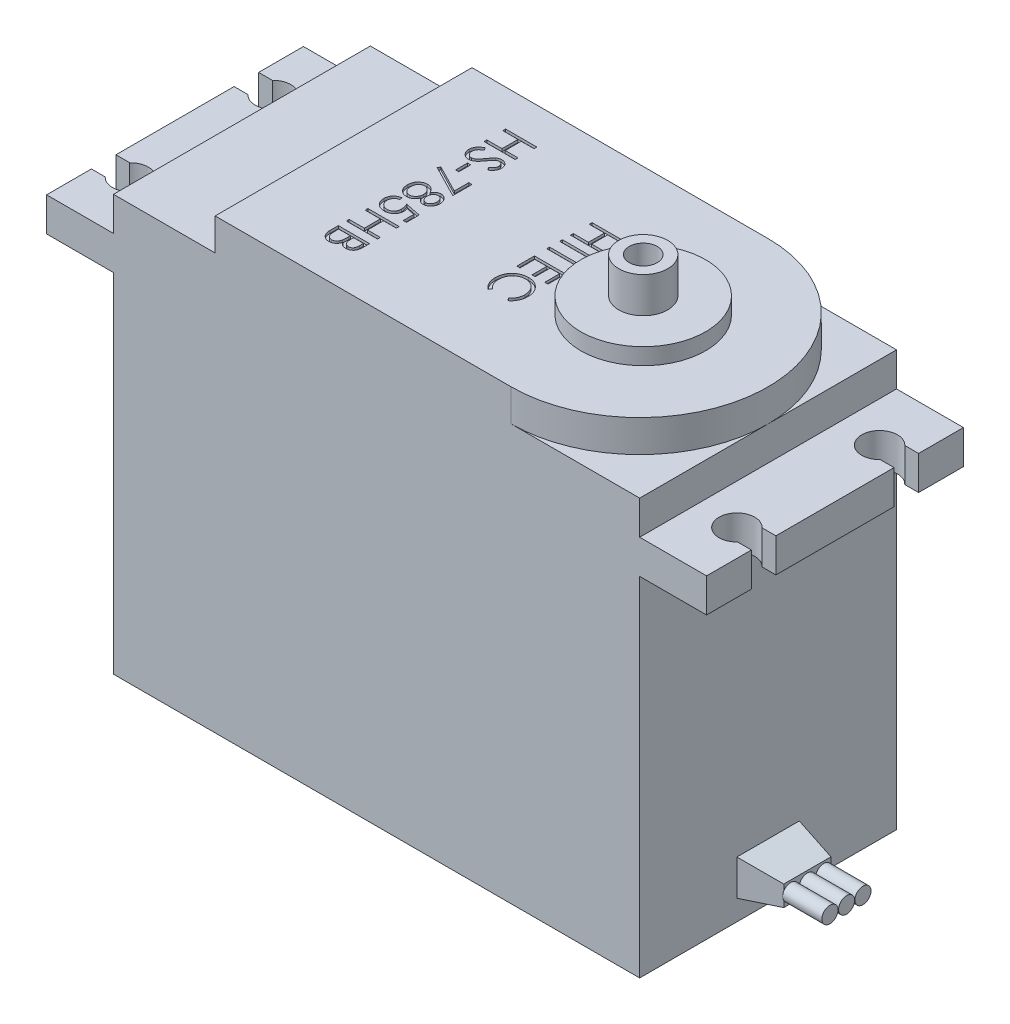
from build123d import *

# Parameters (mm, degrees)
SKETCH1_W                        = 59
SKETCH1_H                        = 46.6
BOSS_EXTRUDE1_DEPTH              = 28.8
BOSS_EXTRUDE2_DEPTH              = 3.6
SKETCH3_R                        = 7
BOSS_EXTRUDE3_DEPTH              = 1.85
BOSS_EXTRUDE4_DEPTH              = 3.8
SKETCH5_W                        = 7
SKETCH5_H                        = 4
BOSS_EXTRUDE5_DEPTH              = 4.4
BOSS_EXTRUDE5_TAPER              = 11
SKETCH6_R                        = 0.902956787
BOSS_EXTRUDE6_DEPTH              = 4.4
SKETCH7_R                        = 2.75
BOSS_EXTRUDE7_DEPTH              = 4
TAP_DRILL_FOR_M3_HELICOIL1_D     = 3.15
TAP_DRILL_FOR_M3_HELICOIL1_DEPTH = 3
TAP_DRILL_FOR_M3_HELICOIL1_TIP   = 0.946355475
SKETCH10_W                       = 3.5
SKETCH10_H                       = 0.314102564
SKETCH10_W_2                     = 0.358974359
SKETCH10_H_2                     = 1.346153846
CUT_EXTRUDE1_DEPTH               = 0.3


with BuildPart() as part:
    # Sketch1 → Boss-Extrude1 (new body)
    with BuildSketch(Plane.XY):
        with Locations((29.5, 23.3)):
            Rectangle(SKETCH1_W, SKETCH1_H)
    extrude(amount=BOSS_EXTRUDE1_DEPTH)

    # Sketch2 → Boss-Extrude2 (add)
    with BuildSketch(Plane(origin=(0, 46.6, 0), x_dir=(1, 0, 0), z_dir=(0, 1, 0))):
        with BuildLine():
            Line((11.4, 0), (44.6, 0))
            ThreePointArc((44.6, 0), (59, -14.4), (44.6, -28.8))
            Line((44.6, -28.8), (11.4, -28.8))
            Line((11.4, -28.8), (11.4, 0))
        make_face()
    extrude(amount=BOSS_EXTRUDE2_DEPTH)

    # Sketch3 → Boss-Extrude3 (add)
    with BuildSketch(Plane(origin=(0, 50.2, 0), x_dir=(1, 0, 0), z_dir=(0, 1, 0))):
        with Locations((45, -14.4)):
            Circle(SKETCH3_R)
    extrude(amount=BOSS_EXTRUDE3_DEPTH)

    # Sketch4 → Boss-Extrude4 (add)
    with BuildSketch(Plane(origin=(0, 39, 0), x_dir=(-1, 0, 0), z_dir=(0, -1, 0))):
        with BuildLine():
            Line((-66.5, 0), (7.5, 0))
            Line((7.5, 0), (7.5, -5.025))
            Line((7.5, -5.025), (5.952368755, -5.025))
            ThreePointArc((5.952368755, -5.025), (2.5, -6.4), (5.952368755, -7.775))
            Line((5.952368755, -7.775), (7.5, -7.775))
            Line((7.5, -7.775), (7.5, -21.025))
            Line((7.5, -21.025), (5.952368755, -21.025))
            ThreePointArc((5.952368755, -21.025), (2.5, -22.4), (5.952368755, -23.775))
            Line((5.952368755, -23.775), (7.5, -23.775))
            Line((7.5, -23.775), (7.5, -28.8))
            Line((7.5, -28.8), (-66.5, -28.8))
            Line((-66.5, -28.8), (-66.5, -23.775))
            Line((-66.5, -23.775), (-64.952368755, -23.775))
            ThreePointArc((-64.952368755, -23.775), (-61.5, -22.4), (-64.952368755, -21.025))
            Line((-64.952368755, -21.025), (-66.5, -21.025))
            Line((-66.5, -21.025), (-66.5, -7.775))
            Line((-66.5, -7.775), (-64.952368755, -7.775))
            ThreePointArc((-64.952368755, -7.775), (-61.5, -6.4), (-64.952368755, -5.025))
            Line((-64.952368755, -5.025), (-66.5, -5.025))
            Line((-66.5, -5.025), (-66.5, 0))
        make_face()
    extrude(amount=-BOSS_EXTRUDE4_DEPTH)

    # Sketch5 → Boss-Extrude5 (add)
    with BuildSketch(Plane(origin=(59, 0, 0), x_dir=(0, 0, -1), z_dir=(1, 0, 0))):
        with Locations((-14.4, 4.3)):
            Rectangle(SKETCH5_W, SKETCH5_H)
    extrude(amount=BOSS_EXTRUDE5_DEPTH, taper=BOSS_EXTRUDE5_TAPER)

    # Sketch6 → Boss-Extrude6 (add)
    with BuildSketch(Plane(origin=(63.4, 0, 0), x_dir=(0, 0, -1), z_dir=(1, 0, 0))):
        with Locations((-14.4, 4.3)):
            Circle(SKETCH6_R)
        with Locations((-12.562723312, 4.3)):
            Circle(SKETCH6_R)
        with Locations((-16.265911653, 4.3)):
            Circle(SKETCH6_R)
    extrude(amount=BOSS_EXTRUDE6_DEPTH)

    # Sketch7 → Boss-Extrude7 (add)
    with BuildSketch(Plane(origin=(0, 52.05, 0), x_dir=(1, 0, 0), z_dir=(0, 1, 0))):
        with Locations((45, -14.4)):
            Circle(SKETCH7_R)
    extrude(amount=BOSS_EXTRUDE7_DEPTH)

    # Tap Drill for M3 Helicoil1
    with Locations(Plane(origin=(0, 56.05, 0), x_dir=(1, 0, 0), z_dir=(0, 1, 0))):
        with Locations((45, -14.4)):
            Hole(TAP_DRILL_FOR_M3_HELICOIL1_D / 2, depth=TAP_DRILL_FOR_M3_HELICOIL1_DEPTH)
            with Locations((0, 0, -(TAP_DRILL_FOR_M3_HELICOIL1_DEPTH + TAP_DRILL_FOR_M3_HELICOIL1_TIP / 2))):  # 118° drill point
                Cone(0, TAP_DRILL_FOR_M3_HELICOIL1_D / 2, TAP_DRILL_FOR_M3_HELICOIL1_TIP, mode=Mode.SUBTRACT)

    # Sketch10 → Cut-Extrude1 (cut)
    # profile 1 of 13: a face of its own
    with BuildSketch(Plane(origin=(0, 50.2, 0), x_dir=(1, 0, 0), z_dir=(0, 1, 0))):
        Polygon((36.683305058, -8.319871795), (36.683305058, -8.633974359), (35.247407622, -8.633974359), (35.247407622, -10.428846154), (36.683305058, -10.428846154), (36.683305058, -10.742948718), (33.183305058, -10.742948718), (33.183305058, -10.428846154), (34.888433263, -10.428846154), (34.888433263, -8.633974359), (33.183305058, -8.633974359), (33.183305058, -8.319871795), align=None)
    # profile 2 of 13: a face of its own
    with BuildSketch(Plane(origin=(0, 50.2, 0), x_dir=(1, 0, 0), z_dir=(0, 1, 0))):
        with Locations((34.933305058, -11.797435897)):
            Rectangle(SKETCH10_W, SKETCH10_H)
    # profile 3 of 13: a face of its own
    with BuildSketch(Plane(origin=(0, 50.2, 0), x_dir=(1, 0, 0), z_dir=(0, 1, 0))):
        Polygon((36.324330699, -12.313461538), (36.683305058, -12.313461538), (36.683305058, -14.153205128), (36.324330699, -14.153205128), (36.324330699, -13.390384615), (33.183305058, -13.390384615), (33.183305058, -13.076282051), (36.324330699, -13.076282051), align=None)
    # profile 4 of 13: a face of its own
    with BuildSketch(Plane(origin=(0, 50.2, 0), x_dir=(1, 0, 0), z_dir=(0, 1, 0))):
        Polygon((36.683305058, -14.781410256), (36.683305058, -16.755769231), (36.324330699, -16.755769231), (36.324330699, -15.095512821), (35.247407622, -15.095512821), (35.247407622, -16.755769231), (34.888433263, -16.755769231), (34.888433263, -15.095512821), (33.542279417, -15.095512821), (33.542279417, -16.755769231), (33.183305058, -16.755769231), (33.183305058, -14.781410256), align=None)
    # profile 5 of 13: a face of its own
    with BuildSketch(Plane(origin=(0, 50.2, 0), x_dir=(1, 0, 0), z_dir=(0, 1, 0))):
        with BuildLine():
            Line((36.041077494, -20.61474359), (35.830740956, -20.339903846))
            add(Edge.make_bspline(
                [(35.830740956, -20.339903846), (35.854106926, -20.320297958), (35.900523841, -20.281350511), (35.965703386, -20.218691308), (36.026768647, -20.153389666), (36.084010527, -20.085470544), (36.135427293, -20.013711425), (36.183698395, -19.939850626), (36.226966133, -19.862652581), (36.27942912, -19.755900846), (36.334175275, -19.616252998), (36.380078506, -19.440458159), (36.409299682, -19.25694706), (36.412464523, -19.131749461), (36.414074289, -19.06806891)],
                knots=[0, 0, 0, 0, 0.757959112, 1.505699292, 2.245454638, 2.979532153, 3.711538275, 4.438200793, 5.171680507, 5.909471876, 7.393775596, 8.890124382, 10.418191784, 12, 12, 12, 12], degree=3))
            add(Edge.make_bspline(
                [(36.414074289, -19.06806891), (36.413668504, -19.032986037), (36.412860699, -18.963145894), (36.402278474, -18.859491127), (36.387233738, -18.757575594), (36.365453359, -18.657778283), (36.33709728, -18.560297345), (36.30384317, -18.464390545), (36.262461804, -18.371187409), (36.21676161, -18.27956626), (36.165128789, -18.191791102), (36.108828525, -18.108723125), (36.048413397, -18.030741827), (35.984039353, -17.95763112), (35.914906353, -17.890192822), (35.841827667, -17.827346132), (35.7639237, -17.770223697), (35.682655477, -17.717421831), (35.597903548, -17.670437615), (35.510201074, -17.629864469), (35.419883374, -17.59508991), (35.326765425, -17.567318559), (35.23121367, -17.54541356), (35.133025326, -17.530280591), (35.032390981, -17.519793562), (34.964181759, -17.518993189), (34.929799449, -17.518589744)],
                knots=[0, 0, 0, 0, 1.055000685, 2.100209969, 3.131349012, 4.153242145, 5.170189196, 6.184191144, 7.204341339, 8.235672124, 9.263040994, 10.265373269, 11.252624173, 12.22887325, 13.193405896, 14.155809299, 15.126090485, 16.097288279, 17.069732292, 18.038585918, 19.002221264, 19.978698174, 20.959418239, 21.948869816, 22.966084182, 24, 24, 24, 24], degree=3))
            add(Edge.make_bspline(
                [(34.929799449, -17.518589744), (34.878068129, -17.519851563), (34.776500545, -17.522328977), (34.627729934, -17.544377311), (34.48520926, -17.577882402), (34.349829418, -17.628097979), (34.21992106, -17.69001703), (34.097682206, -17.768257641), (33.981265642, -17.858874179), (33.873422694, -17.963148598), (33.774908969, -18.077554414), (33.688158387, -18.200302326), (33.615843505, -18.331086613), (33.555667558, -18.468463244), (33.509410831, -18.613489358), (33.476846707, -18.76590416), (33.455604527, -18.925376155), (33.453570839, -19.034345555), (33.452535828, -19.089803686)],
                knots=[0, 0, 0, 0, 1.029171465, 2.020641659, 2.987623507, 3.938342917, 4.889210282, 5.84687017, 6.821220943, 7.821438502, 8.827599549, 9.822697543, 10.807740252, 11.797342354, 12.80366471, 13.83203677, 14.896651826, 16, 16, 16, 16], degree=3))
            add(Edge.make_bspline(
                [(33.452535828, -19.089803686), (33.454224607, -19.150906375), (33.45754853, -19.271171084), (33.485707779, -19.44753911), (33.531365697, -19.616374876), (33.595263619, -19.777687462), (33.678328907, -19.931022109), (33.779026784, -20.076618769), (33.898315117, -20.214600339), (33.989398245, -20.297571622), (34.035869161, -20.339903846)],
                knots=[0, 0, 0, 0, 1.028121516, 2.023589091, 2.998037872, 3.967518031, 4.937445131, 5.927275754, 6.942489185, 8, 8, 8, 8], degree=3))
            Line((34.035869161, -20.339903846), (33.827635988, -20.61474359))
            add(Edge.make_bspline(
                [(33.827635988, -20.61474359), (33.799097487, -20.592625509), (33.742157183, -20.548495293), (33.661886197, -20.47703684), (33.586379459, -20.401761169), (33.516261894, -20.322099407), (33.450069724, -20.239004308), (33.390021991, -20.151012194), (33.334289542, -20.05964286), (33.283933108, -19.96436434), (33.238783038, -19.865489446), (33.200666101, -19.763121075), (33.167359007, -19.658126498), (33.140138788, -19.550452839), (33.11885907, -19.43974039), (33.104641766, -19.326369008), (33.094899211, -19.210099378), (33.094011383, -19.131657923), (33.093561469, -19.091907051)],
                knots=[0, 0, 0, 0, 0.986756325, 1.968786143, 2.935506311, 3.899499537, 4.868307269, 5.8376204, 6.809456583, 7.792545619, 8.781780509, 9.778496008, 10.776623214, 11.79151764, 12.812666265, 13.856269958, 14.913646641, 16, 16, 16, 16], degree=3))
            add(Edge.make_bspline(
                [(33.093561469, -19.091907051), (33.093823461, -19.054263384), (33.094341519, -18.979827694), (33.102733686, -18.869928943), (33.114183423, -18.762939362), (33.131423554, -18.659164736), (33.151767894, -18.558038761), (33.179039151, -18.460478176), (33.209588318, -18.365522966), (33.245493304, -18.273554625), (33.286009487, -18.184494925), (33.331801046, -18.098631114), (33.38248291, -18.016002682), (33.436937921, -17.935797261), (33.496915223, -17.859199677), (33.561581857, -17.785546152), (33.630719868, -17.714423676), (33.680574721, -17.670420991), (33.705640795, -17.648297276)],
                knots=[0, 0, 0, 0, 1.114604814, 2.203992996, 3.262667896, 4.300477797, 5.318619304, 6.316056647, 7.298880507, 8.271930387, 9.238335007, 10.195173496, 11.151986948, 12.108099108, 13.064862484, 14.031167946, 15.010108607, 16, 16, 16, 16], degree=3))
            add(Edge.make_bspline(
                [(33.705640795, -17.648297276), (33.749181984, -17.612861632), (33.835738695, -17.542418155), (33.976024676, -17.452292472), (34.122492885, -17.375144917), (34.275912814, -17.312768996), (34.435940201, -17.264006263), (34.602655715, -17.230225068), (34.775903658, -17.208273463), (34.893740446, -17.205763174), (34.95363759, -17.204487179)],
                knots=[0, 0, 0, 0, 0.994628077, 1.977248131, 2.950237994, 3.925870899, 4.908910175, 5.911660606, 6.938484602, 8, 8, 8, 8], degree=3))
            add(Edge.make_bspline(
                [(34.95363759, -17.204487179), (35.01659041, -17.206049329), (35.140446152, -17.209122761), (35.322257699, -17.235019276), (35.496195366, -17.277183806), (35.662928426, -17.335244644), (35.821502893, -17.411842414), (35.972588496, -17.504570209), (36.116061868, -17.614333755), (36.25008869, -17.739754528), (36.372624778, -17.877329111), (36.480431835, -18.02464603), (36.570149126, -18.181428476), (36.645145349, -18.345946194), (36.702789796, -18.519431912), (36.743142987, -18.701515271), (36.768260102, -18.891854188), (36.77143531, -19.021716614), (36.773048648, -19.087700321)],
                knots=[0, 0, 0, 0, 1.032901378, 2.032168977, 3.007206631, 3.966850309, 4.924221947, 5.891988639, 6.871730993, 7.884084801, 8.900290346, 9.89161143, 10.874607481, 11.860025555, 12.854717796, 13.869097222, 14.917278314, 16, 16, 16, 16], degree=3))
            add(Edge.make_bspline(
                [(36.773048648, -19.087700321), (36.77256687, -19.127914871), (36.771613239, -19.207515525), (36.762301875, -19.325267035), (36.746807469, -19.439913561), (36.725579086, -19.551732359), (36.699560204, -19.661128908), (36.665499477, -19.76698088), (36.625946623, -19.86986468), (36.581554218, -19.969857361), (36.530803527, -20.065871033), (36.475682957, -20.157888224), (36.414920141, -20.244798913), (36.350523899, -20.328237898), (36.280085389, -20.406326703), (36.205898495, -20.481295523), (36.125761834, -20.550554655), (36.06935728, -20.593308111), (36.041077494, -20.61474359)],
                knots=[0, 0, 0, 0, 1.096705196, 2.170817488, 3.219277236, 4.250701065, 5.274195539, 6.284202015, 7.28098643, 8.279664616, 9.266225751, 10.241373748, 11.203306326, 12.157093976, 13.114198862, 14.069774147, 15.032234603, 16, 16, 16, 16], degree=3))
        make_face()
    # profile 6 of 13: a face of its own
    with BuildSketch(Plane(origin=(0, 50.2, 0), x_dir=(1, 0, 0), z_dir=(0, 1, 0))):
        Polygon((22.747407622, -4.079487179), (22.747407622, -4.393589744), (21.311510186, -4.393589744), (21.311510186, -6.188461538), (22.747407622, -6.188461538), (22.747407622, -6.502564103), (19.247407622, -6.502564103), (19.247407622, -6.188461538), (20.952535828, -6.188461538), (20.952535828, -4.393589744), (19.247407622, -4.393589744), (19.247407622, -4.079487179), align=None)
    # profile 7 of 13: a face of its own
    with BuildSketch(Plane(origin=(0, 50.2, 0), x_dir=(1, 0, 0), z_dir=(0, 1, 0))):
        with BuildLine():
            Line((19.922587911, -7.041025641), (20.099971725, -7.336899038))
            add(Edge.make_bspline(
                [(20.099971725, -7.336899038), (20.05390734, -7.364417276), (19.965649756, -7.417141156), (19.846391716, -7.505092515), (19.745029559, -7.596225427), (19.662152951, -7.69121476), (19.596904065, -7.789480708), (19.550701833, -7.891664762), (19.521885858, -7.997422573), (19.518385771, -8.069396394), (19.516638392, -8.105328526)],
                knots=[0, 0, 0, 0, 1.272034388, 2.437168799, 3.508375237, 4.49857839, 5.41946034, 6.295179144, 7.148887113, 8, 8, 8, 8], degree=3))
            add(Edge.make_bspline(
                [(19.516638392, -8.105328526), (19.517493063, -8.136015389), (19.519187451, -8.196852169), (19.535468269, -8.286414365), (19.560480339, -8.373396343), (19.596301492, -8.456004325), (19.639639177, -8.533102307), (19.691988167, -8.600700683), (19.750584394, -8.659176318), (19.81600334, -8.706878063), (19.886116253, -8.743909237), (19.958727613, -8.770706019), (20.033518027, -8.78776056), (20.084223671, -8.78993126), (20.10978743, -8.791025641)],
                knots=[0, 0, 0, 0, 1.095270387, 2.171376115, 3.241375676, 4.322296363, 5.380636668, 6.392615365, 7.366724986, 8.328592944, 9.273498763, 10.190095884, 11.087518669, 12, 12, 12, 12], degree=3))
            add(Edge.make_bspline(
                [(20.10978743, -8.791025641), (20.13892828, -8.78955133), (20.198167369, -8.786554272), (20.285567022, -8.761222792), (20.372059592, -8.721373545), (20.425560857, -8.684610901), (20.45333711, -8.66552484)],
                knots=[0, 0, 0, 0, 0.938893495, 1.908633276, 2.914225137, 4, 4, 4, 4], degree=3))
            add(Edge.make_bspline(
                [(20.45333711, -8.66552484), (20.473424914, -8.649898589), (20.515720536, -8.616996933), (20.577626006, -8.559650246), (20.643041848, -8.494108524), (20.711702424, -8.420044108), (20.782353821, -8.33598475), (20.856468773, -8.243656508), (20.933824538, -8.142581436), (20.98497915, -8.071348293), (21.011430058, -8.034515224)],
                knots=[0, 0, 0, 0, 0.72226686, 1.520759855, 2.393439377, 3.351307446, 4.386958158, 5.510256019, 6.712608938, 8, 8, 8, 8], degree=3))
            add(Edge.make_bspline(
                [(21.011430058, -8.034515224), (21.037664649, -7.99769614), (21.08782319, -7.927300855), (21.162169862, -7.828778771), (21.230577014, -7.740796461), (21.292091762, -7.662905611), (21.349397065, -7.597121357), (21.39942168, -7.54103881), (21.444836864, -7.496727067), (21.474274834, -7.472068628), (21.487491757, -7.460997596)],
                knots=[0, 0, 0, 0, 1.452255772, 2.776602448, 3.96446981, 5.032613149, 5.964194703, 6.766668629, 7.446264616, 8, 8, 8, 8], degree=3))
            add(Edge.make_bspline(
                [(21.487491757, -7.460997596), (21.508092794, -7.445525051), (21.548607498, -7.415096214), (21.611932355, -7.374930209), (21.676755621, -7.340791046), (21.743251485, -7.314028714), (21.810486414, -7.291492495), (21.87933766, -7.276334564), (21.949496278, -7.266843167), (21.996709779, -7.265871181), (22.020344321, -7.265384615)],
                knots=[0, 0, 0, 0, 1.068054152, 2.10047183, 3.106115577, 4.101338837, 5.06977816, 6.043150881, 7.020423561, 8, 8, 8, 8], degree=3))
            add(Edge.make_bspline(
                [(22.020344321, -7.265384615), (22.057377196, -7.266684131), (22.130651394, -7.269255386), (22.237637242, -7.291178507), (22.340091869, -7.325377128), (22.435758513, -7.374838346), (22.524413456, -7.435990725), (22.604702196, -7.508263232), (22.672773126, -7.594070926), (22.731558291, -7.68874351), (22.777971638, -7.791701207), (22.813169233, -7.89939519), (22.832846845, -8.012297701), (22.835702325, -8.088897337), (22.837151212, -8.127764423)],
                knots=[0, 0, 0, 0, 1.005541892, 1.989591032, 2.955705311, 3.932863626, 4.905387107, 5.876519979, 6.856563935, 7.871847665, 8.897921447, 9.918317993, 10.943742853, 12, 12, 12, 12], degree=3))
            add(Edge.make_bspline(
                [(22.837151212, -8.127764423), (22.835755309, -8.169014671), (22.832987065, -8.250818846), (22.808056049, -8.371374893), (22.767784565, -8.487668665), (22.721401583, -8.581279452), (22.675283691, -8.654416578), (22.633260872, -8.710188344), (22.584886653, -8.766706082), (22.530027144, -8.824424052), (22.46818047, -8.882364737), (22.399769759, -8.941388182), (22.325213209, -9.001632453), (22.271988708, -9.040388312), (22.244703295, -9.06025641)],
                knots=[0, 0, 0, 0, 1.286821612, 2.551921131, 3.825787379, 5.12137259, 5.803616487, 6.523126609, 7.299589446, 8.125436757, 9.008162487, 9.944516264, 10.946261234, 12, 12, 12, 12], degree=3))
            Line((22.244703295, -9.06025641), (22.029458904, -8.776302083))
            add(Edge.make_bspline(
                [(22.029458904, -8.776302083), (22.051547595, -8.759156151), (22.09408525, -8.726137094), (22.153656557, -8.676007605), (22.208073065, -8.628758966), (22.255338101, -8.582208537), (22.298040533, -8.538815001), (22.334599308, -8.496697646), (22.365378092, -8.45646431), (22.398208343, -8.405743161), (22.430958948, -8.341857599), (22.458082041, -8.261741847), (22.474968056, -8.178246762), (22.477095496, -8.121534572), (22.478176853, -8.092708333)],
                knots=[0, 0, 0, 0, 1.181667846, 2.275615987, 3.290305621, 4.226321945, 5.078535498, 5.862783384, 6.581873284, 7.217493746, 8.414623899, 9.604724551, 10.782505457, 12, 12, 12, 12], degree=3))
            add(Edge.make_bspline(
                [(22.478176853, -8.092708333), (22.476965153, -8.056551811), (22.474628504, -7.986827364), (22.449108519, -7.887837127), (22.408926658, -7.798743202), (22.35261168, -7.722190637), (22.285890688, -7.65845366), (22.209111833, -7.612348201), (22.12432943, -7.584598037), (22.065187774, -7.581211757), (22.035067879, -7.579487179)],
                knots=[0, 0, 0, 0, 1.14458467, 2.207223713, 3.21896685, 4.227309161, 5.202851033, 6.127160689, 7.046193047, 8, 8, 8, 8], degree=3))
            add(Edge.make_bspline(
                [(22.035067879, -7.579487179), (22.016321181, -7.579898608), (21.978797131, -7.580722137), (21.923212493, -7.59143301), (21.868121261, -7.606620707), (21.813278466, -7.628848836), (21.75739389, -7.658789128), (21.700618414, -7.699498924), (21.641518595, -7.750428556), (21.603118444, -7.789518132), (21.582844321, -7.81015625)],
                knots=[0, 0, 0, 0, 0.858526328, 1.718456515, 2.587092892, 3.476767204, 4.426280253, 5.487868114, 6.673670035, 8, 8, 8, 8], degree=3))
            add(Edge.make_bspline(
                [(21.582844321, -7.81015625), (21.576007295, -7.817817622), (21.559764087, -7.83601929), (21.533171806, -7.869295215), (21.500369034, -7.913238014), (21.459781718, -7.966700215), (21.412700255, -8.030667576), (21.359726643, -8.105147133), (21.299141184, -8.189308665), (21.256783644, -8.249030581), (21.234386789, -8.280608974)],
                knots=[0, 0, 0, 0, 0.420754252, 0.999615792, 1.744751191, 2.668019286, 3.750313428, 4.999500688, 6.413464383, 8, 8, 8, 8], degree=3))
            add(Edge.make_bspline(
                [(21.234386789, -8.280608974), (21.20674543, -8.318594888), (21.153221768, -8.392149344), (21.072806088, -8.496806924), (20.994158319, -8.591700732), (20.917780712, -8.677163936), (20.844252619, -8.754040844), (20.772689439, -8.821478565), (20.703603866, -8.880164245), (20.61503129, -8.943343464), (20.506250206, -9.007901283), (20.372971968, -9.06334279), (20.239175647, -9.098301138), (20.149248811, -9.102872653), (20.104879578, -9.105128205)],
                knots=[0, 0, 0, 0, 1.163667725, 2.253281268, 3.268753668, 4.215851969, 5.092017293, 5.902905408, 6.650798638, 7.335211899, 8.59617414, 9.77448103, 10.901945474, 12, 12, 12, 12], degree=3))
            add(Edge.make_bspline(
                [(20.104879578, -9.105128205), (20.07350146, -9.104470702), (20.011354566, -9.103168464), (19.920095892, -9.088212859), (19.831478401, -9.066273451), (19.746517186, -9.033310155), (19.664075396, -8.992762186), (19.584912437, -8.942679626), (19.510116551, -8.882305131), (19.438131244, -8.815201326), (19.373107817, -8.740626695), (19.314951644, -8.661994883), (19.266275292, -8.578795404), (19.227090704, -8.491430953), (19.195958345, -8.400384812), (19.173581057, -8.305561166), (19.159815692, -8.206695958), (19.158389259, -8.139494884), (19.157664033, -8.105328526)],
                knots=[0, 0, 0, 0, 0.983610584, 1.948120116, 2.894308362, 3.843560551, 4.801159957, 5.773581695, 6.77566113, 7.813174769, 8.857584665, 9.875476876, 10.877851407, 11.875574773, 12.875048225, 13.892438445, 14.928473903, 16, 16, 16, 16], degree=3))
            add(Edge.make_bspline(
                [(19.157664033, -8.105328526), (19.158181072, -8.078894349), (19.159208638, -8.026358908), (19.168077769, -7.948861211), (19.181084459, -7.872786606), (19.200914949, -7.799090303), (19.225541268, -7.726854648), (19.255692632, -7.656723527), (19.291586299, -7.588526555), (19.33328172, -7.522184095), (19.381334224, -7.457071012), (19.436865892, -7.39352112), (19.499493156, -7.330807404), (19.569858274, -7.270079502), (19.647209466, -7.210218042), (19.732194859, -7.152336254), (19.824373289, -7.095255496), (19.889238223, -7.059439893), (19.922587911, -7.041025641)],
                knots=[0, 0, 0, 0, 0.915384692, 1.819241058, 2.699029451, 3.586605375, 4.459625921, 5.340865773, 6.228072412, 7.126546901, 8.052715223, 9.028303326, 10.047266019, 11.120332924, 12.245748783, 13.433636234, 14.680528497, 16, 16, 16, 16], degree=3))
        make_face()
    # profile 8 of 13: a face of its own
    with BuildSketch(Plane(origin=(0, 50.2, 0), x_dir=(1, 0, 0), z_dir=(0, 1, 0))):
        with Locations((20.593561468, -10.182051282)):
            Rectangle(SKETCH10_W_2, SKETCH10_H_2)
    # profile 9 of 13: a face of its own
    with BuildSketch(Plane(origin=(0, 50.2, 0), x_dir=(1, 0, 0), z_dir=(0, 1, 0))):
        Polygon((22.747407622, -11.348717949), (22.747407622, -13.502564103), (19.157664033, -11.662820513), (19.307002975, -11.391486378), (22.388433263, -12.971113782), (22.388433263, -11.348717949), align=None)
    # profile 10 of 13: a face of its own
    with BuildSketch(Plane(origin=(0, 50.2, 0), x_dir=(1, 0, 0), z_dir=(0, 1, 0))):
        with BuildLine():
            add(Edge.make_bspline(
                [(21.197227334, -15.518289263), (21.182271116, -15.546695609), (21.153010253, -15.602270771), (21.10604672, -15.681788287), (21.056987151, -15.754998735), (21.007371571, -15.82294546), (20.955238821, -15.884242578), (20.901183963, -15.939295695), (20.846654955, -15.989831968), (20.789518167, -16.033194521), (20.730952058, -16.071432312), (20.670453196, -16.1044337), (20.608212405, -16.132653753), (20.543534899, -16.155015934), (20.477374822, -16.173437933), (20.40887679, -16.186113482), (20.338492463, -16.192930415), (20.290924159, -16.194219226), (20.266838712, -16.194871795)],
                knots=[0, 0, 0, 0, 1.264385854, 2.473688339, 3.635349404, 4.734491366, 5.785876313, 6.801388178, 7.772322209, 8.711311751, 9.622826105, 10.524996139, 11.423212571, 12.31118177, 13.217849097, 14.126010572, 15.051135535, 16, 16, 16, 16], degree=3))
            add(Edge.make_bspline(
                [(20.266838712, -16.194871795), (20.233138666, -16.194107236), (20.166433629, -16.192593888), (20.068021159, -16.179194139), (19.972215199, -16.159637484), (19.879941981, -16.129183544), (19.790045209, -16.092808209), (19.704168574, -16.04601347), (19.619910751, -15.993499578), (19.568096616, -15.951234031), (19.541878776, -15.929847756)],
                knots=[0, 0, 0, 0, 1.02534174, 2.029536028, 3.018826961, 3.997522084, 4.983122576, 5.966563916, 6.971085759, 8, 8, 8, 8], degree=3))
            add(Edge.make_bspline(
                [(19.541878776, -15.929847756), (19.511285002, -15.902011282), (19.450475509, -15.846682317), (19.371524699, -15.751899389), (19.305175305, -15.647877505), (19.251103411, -15.535019172), (19.209017552, -15.413626071), (19.178775034, -15.283724066), (19.161452605, -15.145059914), (19.158948615, -15.049754442), (19.157664033, -15.000861378)],
                knots=[0, 0, 0, 0, 0.954267603, 1.896743057, 2.838368354, 3.796610408, 4.779680527, 5.799409237, 6.871065594, 8, 8, 8, 8], degree=3))
            add(Edge.make_bspline(
                [(19.157664033, -15.000861378), (19.158819603, -14.953849072), (19.161068227, -14.8623679), (19.176220079, -14.729195118), (19.203044647, -14.604906451), (19.239000366, -14.48891265), (19.286948132, -14.382335231), (19.345718237, -14.284980801), (19.413983223, -14.195421046), (19.493388291, -14.116470754), (19.578448536, -14.046383315), (19.66619954, -13.984815006), (19.756653052, -13.933640993), (19.848459379, -13.89031388), (19.942905544, -13.857145862), (20.039505554, -13.834173651), (20.138090698, -13.819584337), (20.204622351, -13.817643202), (20.238092719, -13.816666667)],
                knots=[0, 0, 0, 0, 1.256882982, 2.445766618, 3.576898315, 4.651879663, 5.686612882, 6.692806257, 7.686348993, 8.689277895, 9.678883454, 10.630458183, 11.551151498, 12.454054546, 13.341321255, 14.221808008, 15.105437234, 16, 16, 16, 16], degree=3))
            add(Edge.make_bspline(
                [(20.238092719, -13.816666667), (20.262651929, -13.81724452), (20.311189598, -13.818386562), (20.382898657, -13.826291813), (20.452695788, -13.838998781), (20.520832847, -13.856263762), (20.586835781, -13.879634311), (20.65093522, -13.907952937), (20.713623656, -13.940653137), (20.773823403, -13.979847905), (20.83354072, -14.022999438), (20.889858769, -14.074186964), (20.945914916, -14.13032768), (20.999283615, -14.193713744), (21.052529979, -14.262405067), (21.102265491, -14.338483625), (21.152129154, -14.419811966), (21.181936678, -14.477618205), (21.197227334, -14.507271635)],
                knots=[0, 0, 0, 0, 0.941717298, 1.86116577, 2.762973304, 3.660719123, 4.553575492, 5.444450535, 6.34648071, 7.261375261, 8.197060099, 9.168336537, 10.175980388, 11.237504102, 12.343496232, 13.506792996, 14.721035322, 16, 16, 16, 16], degree=3))
            add(Edge.make_bspline(
                [(21.197227334, -14.507271635), (21.219358654, -14.466676055), (21.262211085, -14.388071651), (21.3410046, -14.284059164), (21.426030686, -14.194573325), (21.520099482, -14.123082091), (21.619067847, -14.06635321), (21.722618633, -14.026293233), (21.829511921, -14.000133573), (21.902405433, -13.997484347), (21.939014193, -13.996153846)],
                knots=[0, 0, 0, 0, 1.16709546, 2.25982348, 3.287408737, 4.277418348, 5.234967981, 6.16072867, 7.076276605, 8, 8, 8, 8], degree=3))
            add(Edge.make_bspline(
                [(21.939014193, -13.996153846), (21.976311712, -13.997789302), (22.051286229, -14.001076853), (22.162892961, -14.027659686), (22.272507084, -14.070981709), (22.379612466, -14.129894962), (22.480525374, -14.203312055), (22.571338306, -14.29137512), (22.650200088, -14.392577349), (22.716825106, -14.505121891), (22.771320252, -14.626000344), (22.808520752, -14.753758046), (22.832988209, -14.886111927), (22.835750587, -14.976211367), (22.837151212, -15.021895032)],
                knots=[0, 0, 0, 0, 0.888753872, 1.786550278, 2.720173491, 3.693036334, 4.694165094, 5.687489879, 6.699912706, 7.744713188, 8.800178723, 9.852977058, 10.911381959, 12, 12, 12, 12], degree=3))
            add(Edge.make_bspline(
                [(22.837151212, -15.021895032), (22.835711064, -15.066400452), (22.832871256, -15.15416007), (22.808954239, -15.283351314), (22.769452508, -15.407065069), (22.715666001, -15.524626262), (22.64859261, -15.633466216), (22.568935253, -15.730643447), (22.478441412, -15.815885997), (22.377801805, -15.886709686), (22.27069902, -15.943865025), (22.159310157, -15.984568357), (22.045127855, -16.010458995), (21.967894266, -16.013740505), (21.929198488, -16.015384615)],
                knots=[0, 0, 0, 0, 1.072712831, 2.115267497, 3.156282165, 4.197922255, 5.225560591, 6.230883479, 7.219814004, 8.214446311, 9.19021444, 10.138875805, 11.067534608, 12, 12, 12, 12], degree=3))
            add(Edge.make_bspline(
                [(21.929198488, -16.015384615), (21.891221599, -16.013950261), (21.816637147, -16.01113327), (21.707913839, -15.98743039), (21.606079814, -15.947528048), (21.510052326, -15.892992271), (21.42115997, -15.822023961), (21.339698291, -15.734744693), (21.262428992, -15.633863105), (21.21944704, -15.557675022), (21.197227334, -15.518289263)],
                knots=[0, 0, 0, 0, 0.975287281, 1.915408787, 2.843441052, 3.776938647, 4.743139116, 5.754296123, 6.83907365, 8, 8, 8, 8], degree=3))
        make_face()
        with BuildLine():
            add(Edge.make_bspline(
                [(22.478176853, -15.004366987), (22.477525413, -14.979816181), (22.47625091, -14.93178407), (22.469592273, -14.861355399), (22.456639056, -14.794383032), (22.439400345, -14.730167231), (22.416112357, -14.669588419), (22.388717347, -14.611823864), (22.355411282, -14.557856674), (22.318050084, -14.507035372), (22.276957178, -14.461284597), (22.234143459, -14.420680045), (22.188768067, -14.386951931), (22.141959707, -14.358310822), (22.092329131, -14.337529304), (22.041397955, -14.321965), (21.988522571, -14.311443609), (21.95238606, -14.310655219), (21.93410634, -14.31025641)],
                knots=[0, 0, 0, 0, 1.203892937, 2.355340988, 3.463153438, 4.544400666, 5.610487187, 6.640501085, 7.674077295, 8.714426146, 9.728707835, 10.68524104, 11.601827946, 12.495867327, 13.368432065, 14.231010473, 15.105153427, 16, 16, 16, 16], degree=3))
            add(Edge.make_bspline(
                [(21.93410634, -14.31025641), (21.915834067, -14.310967515), (21.87972543, -14.312372759), (21.826189336, -14.322543967), (21.774264483, -14.339550311), (21.723466139, -14.362869666), (21.673924693, -14.392795692), (21.625450305, -14.429116952), (21.579324842, -14.473409414), (21.534239636, -14.522321659), (21.492701969, -14.575749631), (21.45559825, -14.631892711), (21.426019493, -14.691160634), (21.400084968, -14.751778464), (21.380631067, -14.815028124), (21.366615677, -14.880473504), (21.357946284, -14.948044694), (21.356907542, -14.993824498), (21.356381981, -15.016987179)],
                knots=[0, 0, 0, 0, 0.873213166, 1.72559466, 2.594724523, 3.479581045, 4.391597569, 5.35687048, 6.368548091, 7.443976143, 8.534559525, 9.600545123, 10.654815915, 11.696401765, 12.749428718, 13.812189468, 14.893058657, 16, 16, 16, 16], degree=3))
            add(Edge.make_bspline(
                [(21.356381981, -15.016987179), (21.357254849, -15.046737283), (21.358991962, -15.105943651), (21.375143135, -15.193222983), (21.400549053, -15.278085627), (21.435309019, -15.359624531), (21.478936879, -15.435729117), (21.531169897, -15.503569185), (21.590801994, -15.562566078), (21.65690483, -15.612106688), (21.727256418, -15.650516534), (21.797856711, -15.680418342), (21.869458942, -15.697879557), (21.917425906, -15.700157124), (21.941117558, -15.701282051)],
                knots=[0, 0, 0, 0, 1.076279235, 2.141928126, 3.20205304, 4.278698113, 5.344010996, 6.36967002, 7.368914609, 8.37248503, 9.349703398, 10.264243087, 11.142681841, 12, 12, 12, 12], degree=3))
            add(Edge.make_bspline(
                [(21.941117558, -15.701282051), (21.957746396, -15.700751529), (21.990752256, -15.699698518), (22.039478828, -15.690978239), (22.087153586, -15.676679869), (22.133788082, -15.656957889), (22.180038087, -15.632525862), (22.223951085, -15.60096418), (22.267970939, -15.565136341), (22.310146833, -15.52351621), (22.349860569, -15.476596377), (22.384024594, -15.423636111), (22.413695498, -15.365982559), (22.437536477, -15.303165364), (22.45549246, -15.235429641), (22.468924876, -15.163034113), (22.476499111, -15.085390424), (22.477605477, -15.031960565), (22.478176853, -15.004366987)],
                knots=[0, 0, 0, 0, 0.814272661, 1.61621452, 2.416847352, 3.248328223, 4.093649164, 4.973549185, 5.892801723, 6.872536627, 7.872406081, 8.898230315, 9.953166191, 11.044090313, 12.18293744, 13.382234284, 14.648068262, 16, 16, 16, 16], degree=3))
        make_face(mode=Mode.SUBTRACT)
        with BuildLine():
            add(Edge.make_bspline(
                [(20.997407622, -15.024699519), (20.996854189, -14.993573622), (20.995768489, -14.932512207), (20.983676038, -14.843056856), (20.966857387, -14.757197951), (20.941287678, -14.675258784), (20.908314664, -14.597339809), (20.86797303, -14.523265504), (20.820999128, -14.452931049), (20.76713632, -14.387488882), (20.708801533, -14.327864249), (20.647835358, -14.274634425), (20.583799898, -14.230326581), (20.51726637, -14.194121306), (20.448317659, -14.166075579), (20.376967612, -14.145366926), (20.303002969, -14.133345857), (20.252858435, -14.131632895), (20.227575892, -14.130769231)],
                knots=[0, 0, 0, 0, 1.140506561, 2.237395584, 3.304560074, 4.345354409, 5.3782877, 6.402081073, 7.433555996, 8.474808822, 9.504965884, 10.489266388, 11.437701257, 12.354123303, 13.261162422, 14.161620169, 15.073101032, 16, 16, 16, 16], degree=3))
            add(Edge.make_bspline(
                [(20.227575892, -14.130769231), (20.196142974, -14.132128728), (20.133780799, -14.13482594), (20.041647585, -14.156338397), (19.952201998, -14.190595635), (19.867017853, -14.239554372), (19.787156303, -14.298909382), (19.716744394, -14.371419277), (19.655531157, -14.454249754), (19.605339489, -14.548227068), (19.565077991, -14.650740347), (19.537683251, -14.76205528), (19.519411015, -14.880600293), (19.517577164, -14.962461278), (19.516638392, -15.004366987)],
                knots=[0, 0, 0, 0, 0.898956152, 1.783507998, 2.694187257, 3.631865312, 4.587204618, 5.533364321, 6.51415483, 7.525942309, 8.574485006, 9.65837228, 10.801290154, 12, 12, 12, 12], degree=3))
            add(Edge.make_bspline(
                [(19.516638392, -15.004366987), (19.517266488, -15.037117637), (19.518490221, -15.100926406), (19.529314378, -15.194008448), (19.546428882, -15.281866908), (19.571559346, -15.364458676), (19.601667162, -15.442773502), (19.641041814, -15.515060121), (19.68557129, -15.583243899), (19.738423919, -15.644124072), (19.794946853, -15.699489983), (19.854475747, -15.747983414), (19.916404341, -15.789024453), (19.980698961, -15.822107305), (20.047122671, -15.848378292), (20.115948312, -15.867316672), (20.187446178, -15.878988932), (20.23594489, -15.880170368), (20.260528616, -15.880769231)],
                knots=[0, 0, 0, 0, 1.22469164, 2.386092043, 3.500511288, 4.568136916, 5.611981868, 6.63276519, 7.641422348, 8.65223666, 9.641383647, 10.598487484, 11.519869765, 12.415254456, 13.298392158, 14.187051141, 15.081026348, 16, 16, 16, 16], degree=3))
            add(Edge.make_bspline(
                [(20.260528616, -15.880769231), (20.284408634, -15.879869318), (20.331495857, -15.878094848), (20.401223557, -15.866672064), (20.468862436, -15.847059022), (20.534121437, -15.818474069), (20.597705876, -15.783318321), (20.659145959, -15.740195105), (20.717954445, -15.688599251), (20.774192669, -15.630158573), (20.8262125, -15.566507343), (20.872225862, -15.498838166), (20.910978262, -15.42768424), (20.942494682, -15.353192885), (20.967282172, -15.275530368), (20.984598161, -15.194753579), (20.995497766, -15.110768007), (20.996763811, -15.053713136), (20.997407622, -15.024699519)],
                knots=[0, 0, 0, 0, 0.917481483, 1.809113215, 2.707052678, 3.61610275, 4.54058801, 5.494688304, 6.493986409, 7.541809048, 8.607637092, 9.648666143, 10.681335566, 11.715370464, 12.751897579, 13.808646822, 14.885650252, 16, 16, 16, 16], degree=3))
        make_face(mode=Mode.SUBTRACT)
    # profile 11 of 13: a face of its own
    with BuildSketch(Plane(origin=(0, 50.2, 0), x_dir=(1, 0, 0), z_dir=(0, 1, 0))):
        with BuildLine():
            Line((22.747407622, -18.707692308), (22.388433263, -18.707692308))
            Line((22.388433263, -18.707692308), (22.388433263, -17.5171875))
            Line((22.388433263, -17.5171875), (21.467860347, -17.328585737))
            add(Edge.make_bspline(
                [(21.467860347, -17.328585737), (21.478090619, -17.365641612), (21.497910152, -17.437431507), (21.519915923, -17.543391368), (21.533181367, -17.643983572), (21.534992677, -17.709258942), (21.535869161, -17.740845353)],
                knots=[0, 0, 0, 0, 1.100273476, 2.13160584, 3.095893838, 4, 4, 4, 4], degree=3))
            add(Edge.make_bspline(
                [(21.535869161, -17.740845353), (21.535023004, -17.779928957), (21.533359247, -17.85677709), (21.517390544, -17.969217953), (21.492239204, -18.076543886), (21.457160153, -18.178571518), (21.412013882, -18.275520605), (21.356349475, -18.366849739), (21.290551956, -18.453076516), (21.215256161, -18.53306105), (21.132285198, -18.605510473), (21.043366244, -18.669461805), (20.948418419, -18.722648674), (20.847861576, -18.766406309), (20.741864437, -18.801123767), (20.629642414, -18.824294353), (20.512191374, -18.839705921), (20.43188721, -18.841429022), (20.39093727, -18.842307692)],
                knots=[0, 0, 0, 0, 1.052772836, 2.070014431, 3.053871312, 4.019926262, 4.972333346, 5.930471369, 6.896690565, 7.89035727, 8.885779078, 9.861050232, 10.836829716, 11.812751485, 12.812646763, 13.836748493, 14.896881366, 16, 16, 16, 16], degree=3))
            add(Edge.make_bspline(
                [(20.39093727, -18.842307692), (20.362415012, -18.841642707), (20.30575595, -18.840321722), (20.221612298, -18.833601821), (20.139247424, -18.820670991), (20.058662563, -18.803285237), (19.979965449, -18.780809242), (19.903184707, -18.753304938), (19.828083917, -18.720884145), (19.75465816, -18.684280301), (19.685171035, -18.641936438), (19.618549903, -18.59733212), (19.557246563, -18.547922813), (19.499023034, -18.49610067), (19.446165846, -18.439793537), (19.39641301, -18.380749097), (19.351925688, -18.317581726), (19.311007395, -18.251422353), (19.274370744, -18.182312697), (19.243809234, -18.109552002), (19.217021806, -18.034737555), (19.195238127, -17.957202542), (19.178337141, -17.877097172), (19.166827799, -17.794145597), (19.158453751, -17.708764052), (19.157929068, -17.650889159), (19.157664033, -17.621654647)],
                knots=[0, 0, 0, 0, 1.05623316, 2.098192244, 3.122504159, 4.140841222, 5.148757784, 6.150489607, 7.158294732, 8.176043417, 9.185147859, 10.169157858, 11.142149047, 12.097904048, 13.0527185, 13.998867679, 14.954465986, 15.910220987, 16.877849176, 17.847023716, 18.829548819, 19.818454515, 20.826519638, 21.858115382, 22.918063636, 24, 24, 24, 24], degree=3))
            add(Edge.make_bspline(
                [(19.157664033, -17.621654647), (19.158354931, -17.586780509), (19.159714192, -17.518169763), (19.173931815, -17.417648587), (19.194298882, -17.320936204), (19.224923673, -17.228798006), (19.263353327, -17.140456621), (19.311614256, -17.057088043), (19.367068261, -16.977053624), (19.431628689, -16.902528604), (19.502855646, -16.833500739), (19.579322096, -16.770760407), (19.661332081, -16.715737511), (19.748187421, -16.668207508), (19.840037565, -16.627723662), (19.937157363, -16.595904763), (20.039058245, -16.57022748), (20.109211634, -16.559363912), (20.14484352, -16.553846154)],
                knots=[0, 0, 0, 0, 1.046825758, 2.059506013, 3.044032586, 4.011925612, 4.970610144, 5.93275819, 6.900651216, 7.891265644, 8.889116719, 9.876966323, 10.858259055, 11.851035124, 12.847502422, 13.86866322, 14.9174643, 16, 16, 16, 16], degree=3))
            Line((20.14484352, -16.553846154), (20.14484352, -16.867948718))
            add(Edge.make_bspline(
                [(20.14484352, -16.867948718), (20.111463883, -16.875672411), (20.047306367, -16.890517779), (19.957217404, -16.923188256), (19.876633714, -16.962887684), (19.805479223, -17.011168533), (19.743104731, -17.067597128), (19.687040247, -17.131525879), (19.637131008, -17.203865534), (19.595261432, -17.284219978), (19.559605521, -17.369043698), (19.535850407, -17.457808075), (19.519150407, -17.548113161), (19.517478527, -17.609191432), (19.516638392, -17.639883814)],
                knots=[0, 0, 0, 0, 1.136389429, 2.184203582, 3.172920998, 4.111012962, 5.028380909, 5.957351669, 6.927793475, 7.937618031, 8.960409703, 9.974842029, 10.982339866, 12, 12, 12, 12], degree=3))
            add(Edge.make_bspline(
                [(19.516638392, -17.639883814), (19.51745917, -17.669842259), (19.519075288, -17.728830681), (19.5315143, -17.815642067), (19.550671871, -17.899454942), (19.579341726, -17.979442298), (19.614186445, -18.057003838), (19.658901521, -18.130177608), (19.710361539, -18.201080486), (19.769318169, -18.267508619), (19.834287864, -18.328348068), (19.903765257, -18.382104189), (19.977882104, -18.426881103), (20.055355256, -18.464615212), (20.137033814, -18.493268511), (20.222534989, -18.513709492), (20.312069969, -18.525712551), (20.373139279, -18.527363731), (20.404258584, -18.528205128)],
                knots=[0, 0, 0, 0, 1.027316725, 2.022795036, 3.002884548, 3.971462791, 4.93288096, 5.914575861, 6.907176829, 7.935150275, 8.956128384, 9.956726525, 10.942570165, 11.921478529, 12.907843606, 13.90538589, 14.932640048, 16, 16, 16, 16], degree=3))
            add(Edge.make_bspline(
                [(20.404258584, -18.528205128), (20.432351253, -18.527652708), (20.487370167, -18.526570805), (20.567509335, -18.514548207), (20.643886629, -18.497706413), (20.715819031, -18.471847987), (20.784359888, -18.439897706), (20.848042174, -18.399362621), (20.908501999, -18.353026844), (20.963283206, -18.298754833), (21.014184967, -18.239573511), (21.057513714, -18.174109081), (21.09398177, -18.103854735), (21.125448625, -18.029623594), (21.14804969, -17.949659126), (21.165017485, -17.865542372), (21.174832873, -17.776365698), (21.176194758, -17.715395005), (21.176894802, -17.684054487)],
                knots=[0, 0, 0, 0, 1.045726679, 2.048034203, 3.01323695, 3.95502507, 4.889743367, 5.8246644, 6.761650845, 7.722168973, 8.692072792, 9.66525385, 10.638902184, 11.638179751, 12.663148338, 13.728659964, 14.832472288, 16, 16, 16, 16], degree=3))
            add(Edge.make_bspline(
                [(21.176894802, -17.684054487), (21.176333926, -17.656689964), (21.175185726, -17.600670538), (21.166149633, -17.514540765), (21.152248473, -17.424425165), (21.132212465, -17.32997388), (21.107126003, -17.231446115), (21.075796158, -17.128678018), (21.039708128, -17.021667105), (21.011717022, -16.949641098), (20.997407622, -16.912820513)],
                knots=[0, 0, 0, 0, 0.824638674, 1.688163388, 2.607705698, 3.571998603, 4.597075385, 5.671199175, 6.809488238, 8, 8, 8, 8], degree=3))
            Line((20.997407622, -16.912820513), (22.747407622, -17.271794872))
            Line((22.747407622, -17.271794872), (22.747407622, -18.707692308))
        make_face()
    # profile 12 of 13: a face of its own
    with BuildSketch(Plane(origin=(0, 50.2, 0), x_dir=(1, 0, 0), z_dir=(0, 1, 0))):
        Polygon((22.747407622, -19.515384615), (22.747407622, -19.829487179), (21.311510186, -19.829487179), (21.311510186, -21.624358974), (22.747407622, -21.624358974), (22.747407622, -21.938461538), (19.247407622, -21.938461538), (19.247407622, -21.624358974), (20.952535828, -21.624358974), (20.952535828, -19.829487179), (19.247407622, -19.829487179), (19.247407622, -19.515384615), align=None)
    # profile 13 of 13: a face of its own
    with BuildSketch(Plane(origin=(0, 50.2, 0), x_dir=(1, 0, 0), z_dir=(0, 1, 0))):
        with BuildLine():
            Line((22.747407622, -22.835897436), (22.747407622, -23.518790064))
            add(Edge.make_bspline(
                [(22.747407622, -23.518790064), (22.747231872, -23.552218542), (22.746891224, -23.617011253), (22.741608093, -23.711230694), (22.734404423, -23.799479505), (22.72297433, -23.881783277), (22.709182553, -23.95810398), (22.692480737, -24.028671617), (22.672454123, -24.093261789), (22.640607842, -24.170374526), (22.593284674, -24.258295187), (22.523356109, -24.353493579), (22.437823646, -24.434897819), (22.34134099, -24.505084136), (22.235205218, -24.560885256), (22.12194603, -24.601254553), (22.003024288, -24.626812428), (21.92138111, -24.629440862), (21.880119962, -24.630769231)],
                knots=[0, 0, 0, 0, 1.001505555, 1.941167018, 2.826882275, 3.653841531, 4.429895133, 5.150066043, 5.825578002, 6.45369114, 7.647487171, 8.808567382, 9.977351308, 11.170798116, 12.373658725, 13.556498008, 14.765093433, 16, 16, 16, 16], degree=3))
            add(Edge.make_bspline(
                [(21.880119962, -24.630769231), (21.841460857, -24.629697141), (21.765492071, -24.627590384), (21.654558302, -24.606758731), (21.548523751, -24.575743372), (21.448695604, -24.530718236), (21.356356869, -24.472801976), (21.272056312, -24.403106443), (21.197836886, -24.320124799), (21.156517163, -24.257853138), (21.135528616, -24.226221955)],
                knots=[0, 0, 0, 0, 1.044266239, 2.052081639, 3.041743201, 4.026043445, 5.00270663, 5.980942822, 6.97441044, 8, 8, 8, 8], degree=3))
            add(Edge.make_bspline(
                [(21.135528616, -24.226221955), (21.120275397, -24.265989042), (21.091092211, -24.342073329), (21.039215941, -24.446850644), (20.983428672, -24.537485347), (20.922183729, -24.614077199), (20.855342655, -24.678593982), (20.784243906, -24.736531392), (20.705387192, -24.785069952), (20.621017903, -24.826768667), (20.531728183, -24.859585118), (20.43792639, -24.88280491), (20.340661397, -24.897072342), (20.27436542, -24.899017849), (20.240897206, -24.9)],
                knots=[0, 0, 0, 0, 1.272302504, 2.434229863, 3.488457646, 4.447234501, 5.35599188, 6.26022912, 7.18267843, 8.11661068, 9.06895546, 10.019249207, 11.000057067, 12, 12, 12, 12], degree=3))
            add(Edge.make_bspline(
                [(20.240897206, -24.9), (20.206730527, -24.899022847), (20.13950663, -24.897100272), (20.040748729, -24.882924679), (19.946383952, -24.858899479), (19.855741352, -24.825887542), (19.769334, -24.782558009), (19.686079714, -24.730963826), (19.608196332, -24.668167167), (19.533831703, -24.598171401), (19.467008331, -24.518893667), (19.407516974, -24.433371607), (19.358366985, -24.340375133), (19.317595868, -24.241346373), (19.285998461, -24.13562728), (19.264062076, -24.023609833), (19.249246896, -23.90526969), (19.248031116, -23.824059354), (19.247407622, -23.782411859)],
                knots=[0, 0, 0, 0, 0.978404568, 1.925038397, 2.85041836, 3.763147166, 4.682162379, 5.614488577, 6.562659439, 7.54271123, 8.535210642, 9.526693784, 10.520907202, 11.541451354, 12.589717429, 13.675358278, 14.807842563, 16, 16, 16, 16], degree=3))
            Line((19.247407622, -23.782411859), (19.247407622, -22.835897436))
            Line((19.247407622, -22.835897436), (22.747407622, -22.835897436))
        make_face()
        with BuildLine():
            Line((22.388433263, -23.15), (21.266638392, -23.15))
            Line((21.266638392, -23.15), (21.266638392, -23.36103766))
            add(Edge.make_bspline(
                [(21.266638392, -23.36103766), (21.267034987, -23.391886733), (21.267801289, -23.451493429), (21.270065567, -23.538042721), (21.276128005, -23.618180039), (21.282540033, -23.692181524), (21.292413244, -23.759551186), (21.30449528, -23.820514559), (21.317161431, -23.875619285), (21.338762635, -23.939138254), (21.370363265, -24.011167922), (21.420558045, -24.087466235), (21.478719631, -24.155821499), (21.547068196, -24.212897283), (21.621689687, -24.259994782), (21.702590757, -24.291425608), (21.786613054, -24.31371908), (21.844446524, -24.315674073), (21.873809866, -24.316666667)],
                knots=[0, 0, 0, 0, 1.156481963, 2.23455883, 3.244418989, 4.168404366, 5.01828131, 5.794834307, 6.498111525, 7.13526334, 8.307595709, 9.435046769, 10.546766856, 11.659452936, 12.760769924, 13.837671619, 14.902137667, 16, 16, 16, 16], degree=3))
            add(Edge.make_bspline(
                [(21.873809866, -24.316666667), (21.893244787, -24.316170229), (21.931368506, -24.315196412), (21.986730039, -24.306333522), (22.039463851, -24.293473382), (22.088357103, -24.27338192), (22.134799479, -24.249087189), (22.176728164, -24.217484154), (22.21644026, -24.181793611), (22.252477638, -24.139878543), (22.284767269, -24.091941904), (22.313179313, -24.037526947), (22.335591545, -23.975983928), (22.355696511, -23.908708267), (22.369647166, -23.834623276), (22.381311771, -23.754452867), (22.387241213, -23.667516929), (22.38802705, -23.607372002), (22.388433263, -23.576282051)],
                knots=[0, 0, 0, 0, 0.911752476, 1.788502045, 2.626783689, 3.45400582, 4.26402138, 5.080402872, 5.911472738, 6.767166405, 7.66795952, 8.620018292, 9.640966946, 10.73819047, 11.913090943, 13.176185384, 14.540321519, 16, 16, 16, 16], degree=3))
            Line((22.388433263, -23.576282051), (22.388433263, -23.15))
        make_face(mode=Mode.SUBTRACT)
        with BuildLine():
            Line((20.907664033, -23.15), (19.606381981, -23.15))
            Line((19.606381981, -23.15), (19.606381981, -23.597315705))
            add(Edge.make_bspline(
                [(19.606381981, -23.597315705), (19.606764388, -23.62933479), (19.607501428, -23.691047354), (19.609933822, -23.780146471), (19.615350401, -23.862504839), (19.624180871, -23.93816985), (19.633356498, -24.007807562), (19.646056009, -24.070726122), (19.660493818, -24.12702199), (19.682837012, -24.192290181), (19.71748831, -24.265833546), (19.770075364, -24.345032347), (19.831899784, -24.416149618), (19.904355726, -24.475849006), (19.982542707, -24.525146419), (20.066051782, -24.559721572), (20.152335338, -24.581952899), (20.211317155, -24.584579943), (20.240897206, -24.585897436)],
                knots=[0, 0, 0, 0, 1.159821618, 2.235403267, 3.228114831, 4.14795534, 4.994323282, 5.771256229, 6.471395042, 7.097801288, 8.267864287, 9.404187171, 10.531774336, 11.667624178, 12.792825787, 13.866573821, 14.930062559, 16, 16, 16, 16], degree=3))
            add(Edge.make_bspline(
                [(20.240897206, -24.585897436), (20.259392939, -24.585628145), (20.296086067, -24.585093906), (20.349967005, -24.576733964), (20.402392595, -24.565071301), (20.452570087, -24.548182762), (20.501315975, -24.526887683), (20.547781182, -24.500163167), (20.593076709, -24.469301414), (20.650274695, -24.421023435), (20.716198921, -24.350868544), (20.780734011, -24.251156053), (20.832782499, -24.137785369), (20.854881878, -24.055557646), (20.866297847, -24.013080929)],
                knots=[0, 0, 0, 0, 0.723503378, 1.435336582, 2.130201219, 2.824764462, 3.504949994, 4.209866579, 4.920640069, 5.648298893, 7.13757748, 8.670694625, 10.280166878, 12, 12, 12, 12], degree=3))
            add(Edge.make_bspline(
                [(20.866297847, -24.013080929), (20.869753163, -23.99605185), (20.877245001, -23.959129292), (20.885148239, -23.898921405), (20.8922377, -23.829955052), (20.897344092, -23.752525006), (20.902825716, -23.666323319), (20.904881659, -23.571377682), (20.907391046, -23.467620974), (20.907570709, -23.395628514), (20.907664033, -23.358233173)],
                knots=[0, 0, 0, 0, 0.634452549, 1.375623993, 2.216454381, 3.166361212, 4.209414599, 5.370755378, 6.634280627, 8, 8, 8, 8], degree=3))
            Line((20.907664033, -23.358233173), (20.907664033, -23.15))
        make_face(mode=Mode.SUBTRACT)
    extrude(amount=-CUT_EXTRUDE1_DEPTH, mode=Mode.SUBTRACT)


solid = part.part
